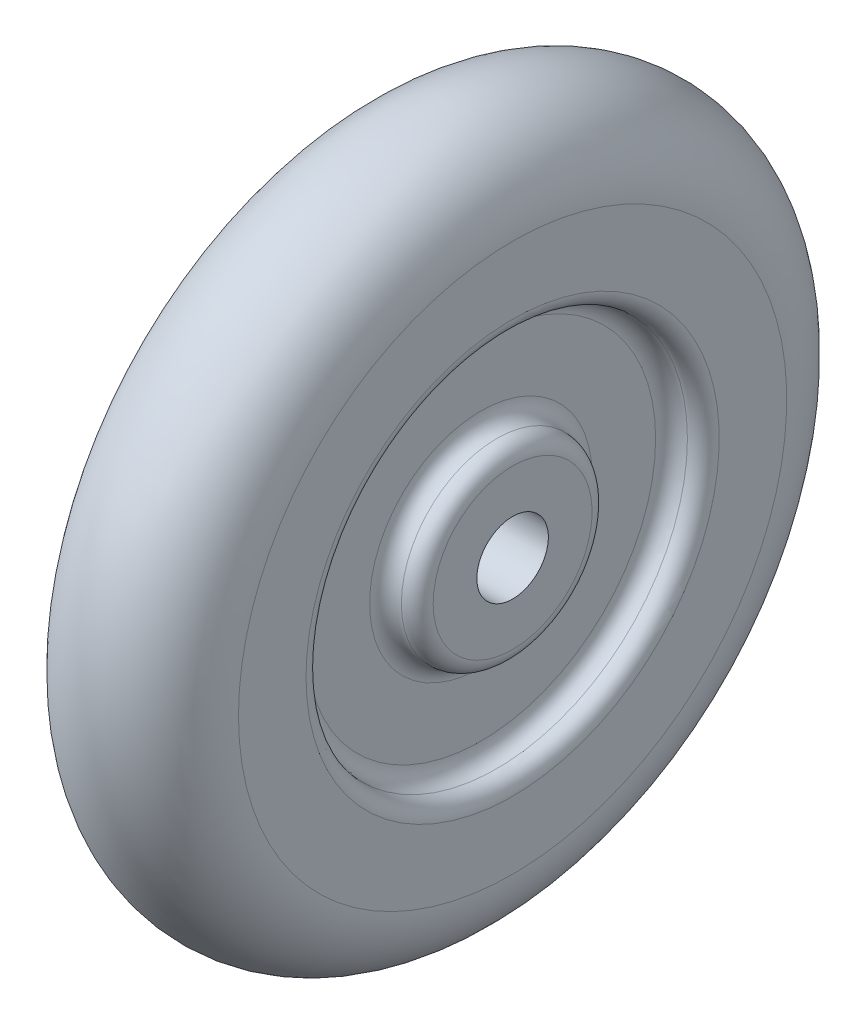
from build123d import *

# Parameters (mm, degrees)
SKETCH4_R          = 12
SKETCH4_R_2        = 6
CUT_EXTRUDE2_DEPTH = 2
FILLET1_R          = 1
FILLET2_R          = 1


with BuildPart() as part:
    # Sketch1 → Revolve1 (revolve)
    with BuildSketch(Plane.XY, mode=Mode.PRIVATE) as revolve1_sk:
        with BuildLine():
            Line((-5, 16.419988569), (-5, 1.419988569))
            Line((-5, 1.419988569), (5, 1.419988569))
            Line((5, 1.419988569), (5, 16.419988569))
            ThreePointArc((5, 16.419988569), (0, 21.419988569), (-5, 16.419988569))
        make_face()
    revolve(revolve1_sk.sketch.rotate(Axis((-11.251793618, -0.830011431, 0), (1, 0, 0)), 90), axis=Axis((-11.251793618, -0.830011431, 0), (1, 0, 0)))

    # Sketch4 → Cut-Extrude2 (cut)
    with BuildSketch(Plane(origin=(5, 0, 0), x_dir=(0, 0, -1), z_dir=(1, 0, 0))):
        with Locations((0, -0.830011431)):
            Circle(SKETCH4_R)
        with Locations((0, -0.830011431)):
            Circle(SKETCH4_R_2, mode=Mode.SUBTRACT)
    cut_extrude2 = extrude(amount=-CUT_EXTRUDE2_DEPTH, mode=Mode.SUBTRACT)

    # Fillet1
    fillet1_edges = [part.edges().sort_by_distance(p)[0] for p in [
        (3, -0.830011431, 12),
        (3, -0.830011431, 6),
    ]]
    fillet(fillet1_edges, radius=FILLET1_R)
    fillet1_2_edges = [part.edges().sort_by_distance(p)[0] for p in [
        (5, -0.830011431, 12),
        (5, -0.830011431, 6),
    ]]
    fillet(fillet1_2_edges, radius=FILLET1_R - 0.0001)  # a hair under: the kernel refuses the full size

    # Mirror2: Cut-Extrude2 across plane
    add(cut_extrude2.mirror(Plane(origin=(0, 0, 0), x_dir=(0, 0, 1), z_dir=(1, 0, 0))), mode=Mode.SUBTRACT)

    # Fillet2
    fillet2_edges = [part.edges().sort_by_distance(p)[0] for p in [
        (-3, -0.830011431, 12),
        (-3, -0.830011431, 6),
    ]]
    fillet(fillet2_edges, radius=FILLET2_R)
    fillet2_2_edges = [part.edges().sort_by_distance(p)[0] for p in [
        (-5, -0.830011431, 6),
        (-5, -0.830011431, 12),
    ]]
    fillet(fillet2_2_edges, radius=FILLET2_R - 0.0001)  # a hair under: the kernel refuses the full size


solid = part.part
